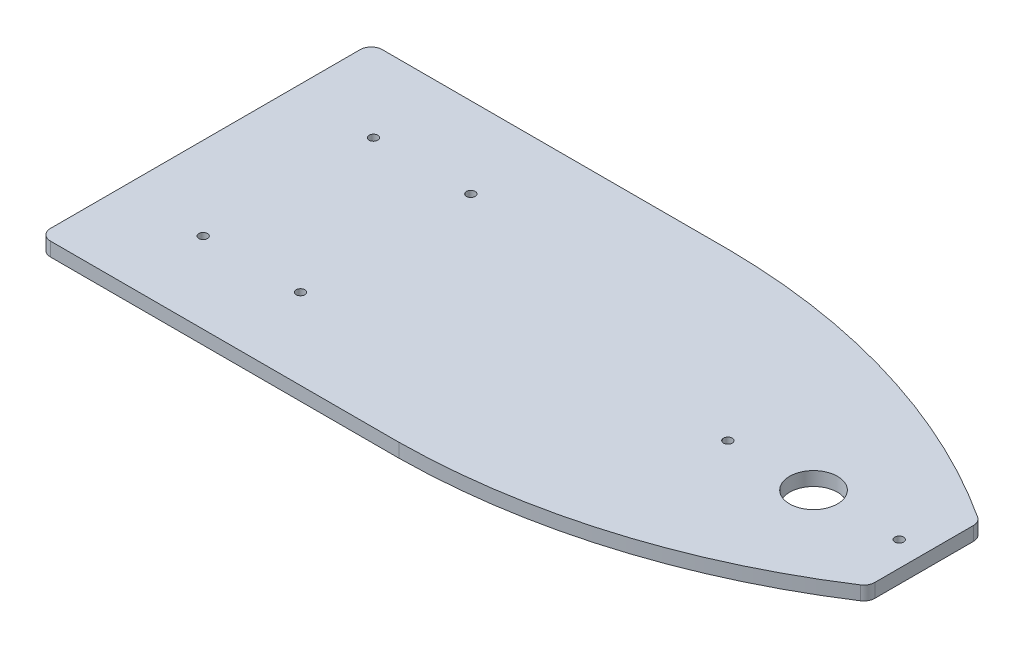
from build123d import *

# Parameters (mm, degrees)
SKETCH1_W           = 165.1
SKETCH1_H           = 76.2
BOSS_EXTRUDE1_DEPTH = 3.175
CUT_EXTRUDE1_DEPTH  = 3.175
FILLET3_R           = 2.54
SKETCH5_R           = 5.5
CUT_EXTRUDE2_DEPTH  = 3.175
SKETCH7_R           = 1.0033
CUT_EXTRUDE4_DEPTH  = 91.973584765
SKETCH6_R           = 1.0033
CUT_EXTRUDE5_DEPTH  = 91.973584765
FILLET4_R           = 2.54


with BuildPart() as part:
    # Sketch1 → Boss-Extrude1 (new body)
    with BuildSketch(Plane(origin=(0, 0, 0), x_dir=(1, 0, 0), z_dir=(0, 1, 0))):
        Rectangle(SKETCH1_W, SKETCH1_H)
    extrude(amount=BOSS_EXTRUDE1_DEPTH)

    # Sketch4 → Cut-Extrude1 (cut)
    with BuildSketch(Plane(origin=(0, 3.175, 0), x_dir=(1, 0, 0), z_dir=(0, 1, 0))):
        with BuildLine():
            Line((82.55, -38.1), (0, -38.1))
            ThreePointArc((0, -38.1), (43.112008449, -31.37027746), (82.55, -12.7))
            Line((82.55, -12.7), (82.55, -38.1))
        make_face()
        with BuildLine():
            Line((82.55, 38.1), (82.55, 12.7))
            ThreePointArc((82.55, 12.7), (43.112008449, 31.37027746), (0, 38.1))
            Line((0, 38.1), (82.55, 38.1))
        make_face()
    extrude(amount=-CUT_EXTRUDE1_DEPTH, mode=Mode.SUBTRACT)

    # Fillet3
    fillet3_edges = [part.edges().sort_by_distance(p)[0] for p in [
        (-82.55, 1.5875, 38.1),
        (-82.55, 1.5875, -38.1),
    ]]
    fillet(fillet3_edges, radius=FILLET3_R)

    # Sketch5 → Cut-Extrude2 (cut)
    with BuildSketch(Plane(origin=(0, 3.175, 0), x_dir=(1, 0, 0), z_dir=(0, 1, 0))):
        with Locations((57.15, 0)):
            Circle(SKETCH5_R)
    extrude(amount=-CUT_EXTRUDE2_DEPTH, mode=Mode.SUBTRACT)

    # Sketch7 → Cut-Extrude4 (cut, through all)
    with BuildSketch(Plane(origin=(0, 3.175, 0), x_dir=(1, 0, 0), z_dir=(0, 1, 0))):
        with Locations((76.835, 0)):
            Circle(SKETCH7_R)
        with Locations((37.465, 0)):
            Circle(SKETCH7_R)
    extrude(amount=-CUT_EXTRUDE4_DEPTH, mode=Mode.SUBTRACT)

    # Sketch6 → Cut-Extrude5 (cut, through all)
    with BuildSketch(Plane(origin=(0, 3.175, 0), x_dir=(1, 0, 0), z_dir=(0, 1, 0))):
        with Locations((-41.131290421, -19.558)):
            Circle(SKETCH6_R)
        with Locations((-63.5, -19.558)):
            Circle(SKETCH6_R)
        with Locations((-63.5, 19.558)):
            Circle(SKETCH6_R)
        with Locations((-41.131290421, 19.558)):
            Circle(SKETCH6_R)
    extrude(amount=-CUT_EXTRUDE5_DEPTH, mode=Mode.SUBTRACT)

    # Fillet4
    fillet4_edges = [part.edges().sort_by_distance(p)[0] for p in [
        (82.55, 1.5875, 12.7),
        (82.55, 1.5875, -12.7),
    ]]
    fillet(fillet4_edges, radius=FILLET4_R)


solid = part.part
